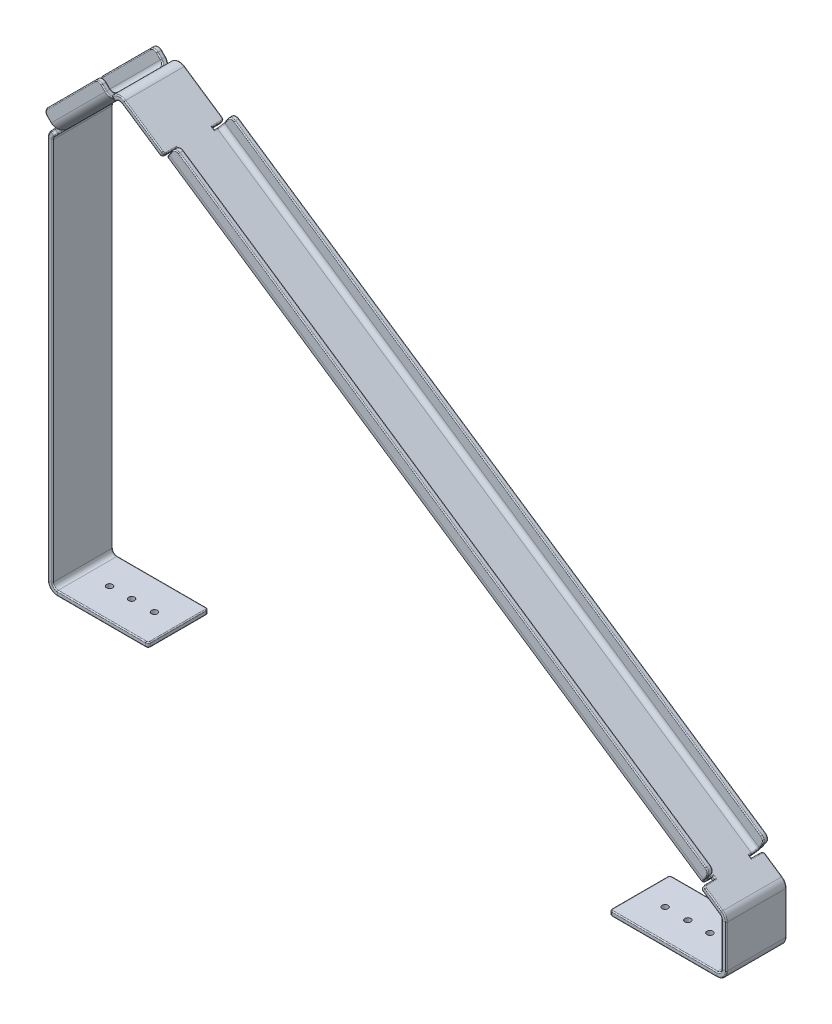
from build123d import *

# Parameters (mm, degrees)
SKETCH2_W                     = 100
SKETCH2_H                     = 60
BASE_FLANGE1_DEPTH            = 4.76
EDGE_FLANGE1_STRIP_W          = 28.5132
EDGE_FLANGE1_STRIP_H          = 4.76
EDGE_FLANGE1_STRIP_CUT_DEPTH  = 60
EDGE_FLANGE1_DEPTH            = 60
EDGE_FLANGE2_START            = -30
EDGE_FLANGE2_DEPTH            = 60
EDGE_FLANGE2_2_DEPTH          = 60
EDGE_FLANGE3_START            = -30
EDGE_FLANGE3_DEPTH            = 60
EDGE_FLANGE3_2_DEPTH          = 60
EDGE_FLANGE4_START            = -30
EDGE_FLANGE4_DEPTH            = 60
EDGE_FLANGE4_2_DEPTH          = 60
EDGE_FLANGE5_STRIP_W          = 28.56
EDGE_FLANGE5_STRIP_H          = 4.76
EDGE_FLANGE5_STRIP_CUT_DEPTH  = 60
EDGE_FLANGE5_DEPTH            = 60
EDGE_FLANGE6_STRIP_W          = 28.56
EDGE_FLANGE6_STRIP_H          = 4.76
EDGE_FLANGE6_STRIP_CUT_DEPTH  = 642.879783277
EDGE_FLANGE6_RELIEF_W         = 30.94
EDGE_FLANGE6_RELIEF_H         = 2.38
EDGE_FLANGE6_RELIEF_CUT_DEPTH = 4.76
EDGE_FLANGE6_DEPTH            = 642.879783277
EDGE_FLANGE7_STRIP_W          = 28.56
EDGE_FLANGE7_STRIP_H          = 4.76
EDGE_FLANGE7_STRIP_CUT_DEPTH  = 642.879783277
EDGE_FLANGE7_RELIEF_W         = 30.94
EDGE_FLANGE7_RELIEF_H         = 2.38
EDGE_FLANGE7_RELIEF_CUT_DEPTH = 4.76
EDGE_FLANGE7_DEPTH            = 642.879783277
EDGE_FLANGE8_STRIP_W          = 28.56
EDGE_FLANGE8_STRIP_H          = 4.76
EDGE_FLANGE8_STRIP_CUT_DEPTH  = 77.283754222
EDGE_FLANGE8_RELIEF_W         = 30.94
EDGE_FLANGE8_RELIEF_H         = 2.38
EDGE_FLANGE8_RELIEF_CUT_DEPTH = 4.76
EDGE_FLANGE8_DEPTH            = 77.283754222
EDGE_FLANGE9_STRIP_W          = 28.56
EDGE_FLANGE9_STRIP_H          = 4.76
EDGE_FLANGE9_STRIP_CUT_DEPTH  = 77.283754222
EDGE_FLANGE9_RELIEF_W         = 30.94
EDGE_FLANGE9_RELIEF_H         = 2.38
EDGE_FLANGE9_RELIEF_CUT_DEPTH = 4.76
EDGE_FLANGE9_DEPTH            = 77.283754222
FILLET1_R                     = 5
FILLET2_R                     = 2.5
FILLET3_R                     = 2.5
FILLET4_R                     = 1
SKETCH39_R                    = 3
CUT_EXTRUDE1_DEPTH            = 10


# Read off the part's stored shape, not the designer's step: Edge-Flange2, Edge-Flange3, Edge-Flange4
# Sheet-metal steps are written as plain solids
with BuildPart() as part:
    # Sketch2 → Base-Flange1 (new body)
    with BuildSketch(Plane(origin=(0, 0, 0), x_dir=(1, 0, 0), z_dir=(0, 1, 0))):
        Rectangle(SKETCH2_W, SKETCH2_H)
    extrude(amount=-BASE_FLANGE1_DEPTH)

    # Edge-Flange1 strip (across the edge) → Edge-Flange1 strip cut (cut)
    with BuildSketch(Plane(origin=(-50, 0, -30), x_dir=(1, 0, 0), z_dir=(0, 0, 1))):
        with Locations((-4.76, -2.38)):
            Rectangle(EDGE_FLANGE1_STRIP_W, EDGE_FLANGE1_STRIP_H)
    extrude(amount=EDGE_FLANGE1_STRIP_CUT_DEPTH, mode=Mode.SUBTRACT)

    # Edge-Flange1 section (across the edge) → Edge-Flange1 (add)
    with BuildSketch(Plane(origin=(-50, 0, -30), x_dir=(1, 0, 0), z_dir=(0, 0, 1))):
        with BuildLine():
            Line((0, 4.7366), (0, 395.24))
            Line((0, 395.24), (4.76, 395.24))
            Line((4.76, 395.24), (4.76, 4.7366))
            ThreePointArc((4.76, 4.7366), (6.14731802, 1.38731802), (9.4966, 0))
            Line((9.4966, 0), (9.4966, -4.76))
            ThreePointArc((9.4966, -4.76), (2.781489742, -1.978510258), (0, 4.7366))
        make_face()
    extrude(amount=EDGE_FLANGE1_DEPTH)

    # Edge-Flange2 outline → Edge-Flange2 (cut)
    with BuildSketch(Plane.XY.offset(EDGE_FLANGE2_START)):
        with BuildLine():
            ThreePointArc((-50, 386.536686886), (-49.27533315, 390.179833162), (-47.211656557, 393.268343443))
            Line((-47.211656557, 393.268343443), (-45.24, 395.24))
            Line((-45.24, 395.24), (-50, 395.24))
            Line((-50, 395.24), (-50, 386.536686886))
        make_face()
    extrude(amount=EDGE_FLANGE2_DEPTH, mode=Mode.SUBTRACT)

    # Edge-Flange2 2 outline → Edge-Flange2 2 (add)
    with BuildSketch(Plane.XY.offset(EDGE_FLANGE2_START)):
        with BuildLine():
            Line((20.710678119, 461.190678119), (-45.24, 395.24))
            Line((-45.24, 395.24), (-45.24, 386.536686886))
            ThreePointArc((-45.24, 386.536686886), (-44.877666575, 388.358260024), (-43.845828278, 389.902515165))
            Line((-43.845828278, 389.902515165), (24.076506397, 457.82484984))
            Line((24.076506397, 457.82484984), (20.710678119, 461.190678119))
        make_face()
    extrude(amount=EDGE_FLANGE2_2_DEPTH)

    # Edge-Flange3 outline → Edge-Flange3 (cut)
    with BuildSketch(Plane.XY.offset(EDGE_FLANGE3_START)):
        with BuildLine():
            ThreePointArc((14.507277941, 454.987277941), (18.774977189, 457.45123525), (23.702891807, 457.45123525))
            Line((23.702891807, 457.45123525), (24.076506397, 457.82484984))
            Line((24.076506397, 457.82484984), (20.710678119, 461.190678119))
            Line((20.710678119, 461.190678119), (14.507277941, 454.987277941))
        make_face()
    extrude(amount=EDGE_FLANGE3_DEPTH, mode=Mode.SUBTRACT)

    # Edge-Flange3 2 outline → Edge-Flange3 2 (add)
    with BuildSketch(Plane.XY.offset(EDGE_FLANGE3_START)):
        with BuildLine():
            Line((628.570005633, 50.08883623), (26.562450939, 456.148059075))
            ThreePointArc((26.562450939, 456.148059075), (25.186814168, 456.918452683), (23.702891807, 457.45123525))
            Line((23.702891807, 457.45123525), (17.873106219, 451.621449662))
            ThreePointArc((17.873106219, 451.621449662), (20.782708715, 452.993707288), (23.900692718, 452.201840229))
            Line((23.900692718, 452.201840229), (625.908247412, 46.142617385))
            Line((625.908247412, 46.142617385), (628.570005633, 50.08883623))
        make_face()
    extrude(amount=EDGE_FLANGE3_2_DEPTH)

    # Edge-Flange4 outline → Edge-Flange4 (cut)
    with BuildSketch(Plane.XY.offset(EDGE_FLANGE4_START)):
        with BuildLine():
            ThreePointArc((621.711763853, 54.714778721), (624.793908496, 51.291710308), (625.908247412, 46.82234103))
            Line((625.908247412, 46.82234103), (625.908247412, 46.142617385))
            Line((625.908247412, 46.142617385), (628.570005633, 50.08883623))
            Line((628.570005633, 50.08883623), (621.711763853, 54.714778721))
        make_face()
    extrude(amount=EDGE_FLANGE4_DEPTH, mode=Mode.SUBTRACT)

    # Edge-Flange4 2 outline → Edge-Flange4 2 (add)
    with BuildSketch(Plane.XY.offset(EDGE_FLANGE4_START)):
        with BuildLine():
            Line((625.908247412, -4.865785181), (625.908247412, 46.142617385))
            Line((625.908247412, 46.142617385), (619.050005633, 50.768559875))
            ThreePointArc((619.050005633, 50.768559875), (620.591077954, 49.057025669), (621.148247412, 46.82234103))
            Line((621.148247412, 46.82234103), (621.148247412, -4.865785181))
            Line((621.148247412, -4.865785181), (625.908247412, -4.865785181))
        make_face()
    extrude(amount=EDGE_FLANGE4_2_DEPTH)

    # Edge-Flange5 strip (across the edge) → Edge-Flange5 strip cut (cut)
    with BuildSketch(Plane(origin=(621.148247412, -4.865785181, -30), x_dir=(0, 1, 0), z_dir=(0, 0, 1))):
        with Locations((-4.76, -2.38)):
            Rectangle(EDGE_FLANGE5_STRIP_W, EDGE_FLANGE5_STRIP_H)
    extrude(amount=EDGE_FLANGE5_STRIP_CUT_DEPTH, mode=Mode.SUBTRACT)

    # Edge-Flange5 section (across the edge) → Edge-Flange5 (add)
    with BuildSketch(Plane(origin=(621.148247412, -4.865785181, -30), x_dir=(0, 1, 0), z_dir=(0, 0, 1))):
        with BuildLine():
            Line((0, 4.76), (0, 111.4966))
            Line((0, 111.4966), (4.76, 111.4966))
            Line((4.76, 111.4966), (4.76, 4.76))
            ThreePointArc((4.76, 4.76), (6.154171722, 1.394171722), (9.52, 0))
            Line((9.52, 0), (9.52, -4.76))
            ThreePointArc((9.52, -4.76), (2.788343443, -1.971656557), (0, 4.76))
        make_face()
    extrude(amount=EDGE_FLANGE5_DEPTH)

    # Edge-Flange6 strip (across the edge) → Edge-Flange6 strip cut (cut)
    with BuildSketch(Plane(origin=(68.014329566, 428.188413901, 30), x_dir=(0, 0, -1), z_dir=(0.8290375725550491, -0.559192903470736, 0))):
        with Locations((-4.76, -2.38)):
            Rectangle(EDGE_FLANGE6_STRIP_W, EDGE_FLANGE6_STRIP_H)
    extrude(amount=EDGE_FLANGE6_STRIP_CUT_DEPTH, mode=Mode.SUBTRACT)

    # Edge-Flange6 relief (on the sheet) → Edge-Flange6 relief cut (cut)
    with BuildSketch(Plane(origin=(68.014329566, 428.188413901, 20.48), x_dir=(0, 0, -1), z_dir=(0.559192903470736, 0.8290375725550491, 6.8742211887429995e-15))):
        with Locations((-13.09, 1.19)):
            Rectangle(EDGE_FLANGE6_RELIEF_W, EDGE_FLANGE6_RELIEF_H)
        with Locations((-13.09, -644.069783277)):
            Rectangle(EDGE_FLANGE6_RELIEF_W, EDGE_FLANGE6_RELIEF_H)
    extrude(amount=-EDGE_FLANGE6_RELIEF_CUT_DEPTH, mode=Mode.SUBTRACT)

    # Edge-Flange6 section (across the edge) → Edge-Flange6 (add)
    with BuildSketch(Plane(origin=(68.014329566, 428.188413901, 30), x_dir=(0, 0, -1), z_dir=(0.8290375725550491, -0.559192903470736, 0))):
        with BuildLine():
            Line((0, 4.76), (0, 15.24))
            Line((0, 15.24), (4.76, 15.24))
            Line((4.76, 15.24), (4.76, 4.76))
            ThreePointArc((4.76, 4.76), (6.154171722, 1.394171722), (9.52, 0))
            Line((9.52, 0), (9.52, -4.76))
            ThreePointArc((9.52, -4.76), (2.788343443, -1.971656557), (0, 4.76))
        make_face()
    extrude(amount=EDGE_FLANGE6_DEPTH)

    # Edge-Flange7 strip (across the edge) → Edge-Flange7 strip cut (cut)
    with BuildSketch(Plane(origin=(600.985824539, 68.694601307, -30), x_dir=(0, 0, 1), z_dir=(-0.829037572555049, 0.5591929034707361, 0))):
        with Locations((-4.76, -2.38)):
            Rectangle(EDGE_FLANGE7_STRIP_W, EDGE_FLANGE7_STRIP_H)
    extrude(amount=EDGE_FLANGE7_STRIP_CUT_DEPTH, mode=Mode.SUBTRACT)

    # Edge-Flange7 relief (on the sheet) → Edge-Flange7 relief cut (cut)
    with BuildSketch(Plane(origin=(600.985824539, 68.694601307, -20.48), x_dir=(0, 0, 1), z_dir=(0.5591929034707361, 0.829037572555049, -6.943642976771755e-15))):
        with Locations((-13.09, 1.19)):
            Rectangle(EDGE_FLANGE7_RELIEF_W, EDGE_FLANGE7_RELIEF_H)
        with Locations((-13.09, -644.069783277)):
            Rectangle(EDGE_FLANGE7_RELIEF_W, EDGE_FLANGE7_RELIEF_H)
    extrude(amount=-EDGE_FLANGE7_RELIEF_CUT_DEPTH, mode=Mode.SUBTRACT)

    # Edge-Flange7 section (across the edge) → Edge-Flange7 (add)
    with BuildSketch(Plane(origin=(600.985824539, 68.694601307, -30), x_dir=(0, 0, 1), z_dir=(-0.829037572555049, 0.5591929034707361, 0))):
        with BuildLine():
            Line((0, 4.76), (0, 15.24))
            Line((0, 15.24), (4.76, 15.24))
            Line((4.76, 15.24), (4.76, 4.76))
            ThreePointArc((4.76, 4.76), (6.154171722, 1.394171722), (9.52, 0))
            Line((9.52, 0), (9.52, -4.76))
            ThreePointArc((9.52, -4.76), (2.788343443, -1.971656557), (0, 4.76))
        make_face()
    extrude(amount=EDGE_FLANGE7_DEPTH)

    # Edge-Flange8 strip (across the edge) → Edge-Flange8 strip cut (cut)
    with BuildSketch(Plane(origin=(-43.676122651, 396.803877349, 30), x_dir=(0, 0, -1), z_dir=(0.7071067811865411, 0.7071067811865539, 0))):
        with Locations((-4.76, -2.38)):
            Rectangle(EDGE_FLANGE8_STRIP_W, EDGE_FLANGE8_STRIP_H)
    extrude(amount=EDGE_FLANGE8_STRIP_CUT_DEPTH, mode=Mode.SUBTRACT)

    # Edge-Flange8 relief (on the sheet) → Edge-Flange8 relief cut (cut)
    with BuildSketch(Plane(origin=(-43.676122651, 396.803877349, 20.48), x_dir=(0, 0, -1), z_dir=(-0.7071067811865539, 0.7071067811865411, 6.945684747947444e-15))):
        with Locations((-13.09, 1.19)):
            Rectangle(EDGE_FLANGE8_RELIEF_W, EDGE_FLANGE8_RELIEF_H)
        with Locations((-13.09, -78.473754222)):
            Rectangle(EDGE_FLANGE8_RELIEF_W, EDGE_FLANGE8_RELIEF_H)
    extrude(amount=-EDGE_FLANGE8_RELIEF_CUT_DEPTH, mode=Mode.SUBTRACT)

    # Edge-Flange8 section (across the edge) → Edge-Flange8 (add)
    with BuildSketch(Plane(origin=(-43.676122651, 396.803877349, 30), x_dir=(0, 0, -1), z_dir=(0.7071067811865411, 0.7071067811865539, 0))):
        with BuildLine():
            Line((0, 4.76), (0, 15.24))
            Line((0, 15.24), (4.76, 15.24))
            Line((4.76, 15.24), (4.76, 4.76))
            ThreePointArc((4.76, 4.76), (6.154171722, 1.394171722), (9.52, 0))
            Line((9.52, 0), (9.52, -4.76))
            ThreePointArc((9.52, -4.76), (2.788343443, -1.971656557), (0, 4.76))
        make_face()
    extrude(amount=EDGE_FLANGE8_DEPTH)

    # Edge-Flange9 strip (across the edge) → Edge-Flange9 strip cut (cut)
    with BuildSketch(Plane(origin=(10.971744035, 451.451744035, -30), x_dir=(0, 0, 1), z_dir=(-0.7071067811865414, -0.7071067811865538, 0))):
        with Locations((-4.76, -2.38)):
            Rectangle(EDGE_FLANGE9_STRIP_W, EDGE_FLANGE9_STRIP_H)
    extrude(amount=EDGE_FLANGE9_STRIP_CUT_DEPTH, mode=Mode.SUBTRACT)

    # Edge-Flange9 relief (on the sheet) → Edge-Flange9 relief cut (cut)
    with BuildSketch(Plane(origin=(10.971744035, 451.451744035, -20.48), x_dir=(0, 0, 1), z_dir=(-0.7071067811865538, 0.7071067811865414, -6.9849370594145335e-15))):
        with Locations((-13.09, 1.19)):
            Rectangle(EDGE_FLANGE9_RELIEF_W, EDGE_FLANGE9_RELIEF_H)
        with Locations((-13.09, -78.473754222)):
            Rectangle(EDGE_FLANGE9_RELIEF_W, EDGE_FLANGE9_RELIEF_H)
    extrude(amount=-EDGE_FLANGE9_RELIEF_CUT_DEPTH, mode=Mode.SUBTRACT)

    # Edge-Flange9 section (across the edge) → Edge-Flange9 (add)
    with BuildSketch(Plane(origin=(10.971744035, 451.451744035, -30), x_dir=(0, 0, 1), z_dir=(-0.7071067811865414, -0.7071067811865538, 0))):
        with BuildLine():
            Line((0, 4.76), (0, 15.24))
            Line((0, 15.24), (4.76, 15.24))
            Line((4.76, 15.24), (4.76, 4.76))
            ThreePointArc((4.76, 4.76), (6.154171722, 1.394171722), (9.52, 0))
            Line((9.52, 0), (9.52, -4.76))
            ThreePointArc((9.52, -4.76), (2.788343443, -1.971656557), (0, 4.76))
        make_face()
    extrude(amount=EDGE_FLANGE9_DEPTH)

    # Fillet1
    fillet1_edges = [part.edges().sort_by_distance(p)[0] for p in [
        (76.536429415, 440.822946507, 27.62),
        (609.507924388, 81.329133913, 27.62),
        (609.507924388, 81.329133913, -27.62),
        (76.536429415, 440.822946507, -27.62),
        (-54.452429996, 407.580184694, 27.62),
        (0.195436689, 462.22805138, 27.62),
        (0.195436689, 462.22805138, -27.62),
        (-54.452429996, 407.580184694, -27.62),
    ]]
    fillet(fillet1_edges, radius=FILLET1_R)

    # Fillet2
    fillet2_edges = [part.edges().sort_by_distance(p)[0] for p in [
        (601.628054852, 65.390612775, 30),
        (64.710341033, 427.546183589, 30),
        (64.710341033, 427.546183589, -30),
        (601.628054852, 65.390612775, -30),
        (14.337572313, 451.451744035, 30),
        (-43.676122651, 393.438049071, 30),
        (-43.676122651, 393.438049071, -30),
        (14.337572313, 451.451744035, -30),
    ]]
    fillet(fillet2_edges, radius=FILLET2_R)

    # Fillet3
    fillet3_edges = [part.edges().sort_by_distance(p)[0] for p in [
        (509.651647412, -2.485785181, -30),
        (509.651647412, -2.485785181, 30),
        (50, -2.38, 30),
        (50, -2.38, -30),
    ]]
    fillet(fillet3_edges, radius=FILLET3_R)

    # Fillet4
    fillet4_edges = [part.edges().sort_by_distance(p)[0] for p in [
        (42.603780355, 439.586448327, 30),
        (45.265538576, 443.532667173, 30),
        (610.709887653, 56.394040484, -30),
        (613.371645873, 60.34025933, -30),
        (624.793908496, 51.291710308, -30),
        (624.793908496, 51.291710308, 30),
        (620.591077954, 49.057025669, -30),
        (620.591077954, 49.057025669, 30),
        (621.148247412, 25.738277925, 30),
        (625.908247412, 25.738277925, 30),
        (3.4983, 0, 30),
        (621.148247412, 25.738277925, -30),
        (625.908247412, 25.738277925, -30),
        (3.4983, -4.76, 30),
        (623.119903969, -2.077441738, -30),
        (623.119903969, -2.077441738, 30),
        (619.754075691, 1.288386541, -30),
        (619.754075691, 1.288386541, 30),
        (564.269947412, -0.105785181, 30),
        (564.269947412, -4.865785181, 30),
        (63.379461923, 425.573074166, 22.8),
        (64.366016635, 424.907634611, 18.1),
        (65.352571346, 424.242195056, 19.29),
        (598.324066319, 64.748382462, 19.29),
        (599.31062103, 64.082942907, 18.1),
        (601.972379251, 68.029161752, 18.1),
        (600.985824539, 68.694601307, 19.29),
        (68.014329566, 428.188413901, 19.29),
        (67.027774855, 428.853853456, 18.1),
        (66.041220144, 429.519293011, 22.8),
        (66.911793212, 426.553836535, 27.211656557),
        (599.883288185, 67.060023942, 27.211656557),
        (68.793940499, 429.344234641, 23.845828278),
        (601.765435472, 69.850422047, 23.845828278),
        (605.179771315, 74.912383102, 25.24),
        (605.179771315, 74.912383102, 30),
        (599.31062103, 64.082942907, -18.1),
        (598.324066319, 64.748382462, -19.29),
        (65.352571346, 424.242195056, -19.29),
        (64.366016635, 424.907634611, -18.1),
        (600.297175742, 63.417503352, -22.8),
        (67.027774855, 428.853853456, -18.1),
        (68.014329566, 428.188413901, -19.29),
        (600.985824539, 68.694601307, -19.29),
        (601.972379251, 68.029161752, -18.1),
        (602.958933962, 67.363722197, -22.8),
        (599.883288185, 67.060023942, -27.211656557),
        (66.911793212, 426.553836535, -27.211656557),
        (601.765435472, 69.850422047, -23.845828278),
        (68.793940499, 429.344234641, -23.845828278),
        (72.208276342, 434.406195695, -25.24),
        (72.208276342, 434.406195695, -30),
        (-47.218510258, -1.978510258, -30),
        (-47.218510258, -1.978510258, 30),
        (-43.85268198, 1.38731802, -30),
        (-43.85268198, 1.38731802, 30),
        (-41.993208512, 391.755134931, 22.8),
        (-41.151751442, 392.596592001, 18.1),
        (-40.310294373, 393.438049071, 19.29),
        (14.337572313, 448.085915756, 19.29),
        (15.179029383, 448.927372826, 18.1),
        (11.813201104, 452.293201104, 18.1),
        (10.971744035, 451.451744035, 19.29),
        (-43.676122651, 396.803877349, 19.29),
        (-44.517579721, 395.962420279, 18.1),
        (-45.35903679, 395.12096321, 22.8),
        (-42.281950929, 395.409705627, 27.211656557),
        (12.365915756, 450.057572313, 27.211656557),
        (-44.661950929, 397.789705627, 23.845828278),
        (9.985915756, 452.437572313, 23.845828278),
        (5.668443176, 456.755044894, 25.24),
        (5.668443176, 456.755044894, 30),
        (15.179029383, 448.927372826, -18.1),
        (14.337572313, 448.085915756, -19.29),
        (-40.310294373, 393.438049071, -19.29),
        (-41.151751442, 392.596592001, -18.1),
        (16.020486452, 449.768829896, -22.8),
        (-44.517579721, 395.962420279, -18.1),
        (-43.676122651, 396.803877349, -19.29),
        (10.971744035, 451.451744035, -19.29),
        (11.813201104, 452.293201104, -18.1),
        (12.654658174, 453.134658174, -22.8),
        (-45.24, 195.636643443, 30),
        (-50, 195.636643443, 30),
        (12.365915756, 450.057572313, -27.211656557),
        (-42.281950929, 395.409705627, -27.211656557),
        (9.985915756, 452.437572313, -23.845828278),
        (-44.661950929, 397.789705627, -23.845828278),
        (-48.97942351, 402.107178208, -25.24),
        (-48.97942351, 402.107178208, -30),
        (605.179771315, 74.912383102, -30),
        (605.179771315, 74.912383102, -25.24),
        (343.022176902, 261.07604021, -25.24),
        (76.931607784, 438.789930044, -25.24),
        (607.474907925, 80.933955545, -25.24),
        (343.022176902, 261.07604021, -30),
        (76.931607784, 438.789930044, -30),
        (607.474907925, 80.933955545, -30),
        (343.022176902, 261.07604021, 25.24),
        (343.022176902, 261.07604021, 30),
        (72.208276342, 434.406195695, 25.24),
        (76.931607784, 438.789930044, 25.24),
        (607.474907925, 80.933955545, 25.24),
        (72.208276342, 434.406195695, 30),
        (76.931607784, 438.789930044, 30),
        (607.474907925, 80.933955545, 30),
        (-27.128496653, 434.904118037, 25.24),
        (-27.128496653, 434.904118037, 30),
        (-48.97942351, 402.107178208, 25.24),
        (-52.381362184, 407.580184694, 25.24),
        (0.195436689, 460.156983568, 25.24),
        (-48.97942351, 402.107178208, 30),
        (-52.381362184, 407.580184694, 30),
        (0.195436689, 460.156983568, 30),
        (5.668443176, 456.755044894, -30),
        (5.668443176, 456.755044894, -25.24),
        (-27.128496653, 434.904118037, -25.24),
        (-52.381362184, 407.580184694, -25.24),
        (0.195436689, 460.156983568, -25.24),
        (-27.128496653, 434.904118037, -30),
        (-52.381362184, 407.580184694, -30),
        (0.195436689, 460.156983568, -30),
        (610.709887653, 56.394040484, 30),
        (613.371645873, 60.34025933, 30),
        (42.603780355, 439.586448327, -30),
        (63.379461923, 425.573074166, -22.8),
        (600.297175742, 63.417503352, 22.8),
        (62.772413215, 425.982533689, 29.267766953),
        (62.772413215, 425.982533689, -29.267766953),
        (600.90422445, 63.008043828, -29.267766953),
        (600.90422445, 63.008043828, 29.267766953),
        (602.958933962, 67.363722197, 22.8),
        (66.041220144, 429.519293011, -22.8),
        (45.265538576, 443.532667173, -30),
        (65.434171436, 429.928752535, 29.267766953),
        (65.434171436, 429.928752535, -29.267766953),
        (603.56598267, 66.954262674, -29.267766953),
        (603.56598267, 66.954262674, 29.267766953),
        (-43.803401871, 389.944941572, -30),
        (-47.16923015, 393.31076985, -30),
        (-41.993208512, 391.755134931, -22.8),
        (17.830679812, 451.579023255, 30),
        (16.020486452, 449.768829896, 22.8),
        (16.538253405, 450.286596848, -29.267766953),
        (16.538253405, 450.286596848, 29.267766953),
        (-42.510975465, 391.237367978, 29.267766953),
        (-42.510975465, 391.237367978, -29.267766953),
        (-45.35903679, 395.12096321, -22.8),
        (12.654658174, 453.134658174, 22.8),
        (14.464851534, 454.944851534, 30),
        (13.172425127, 453.652425127, -29.267766953),
        (13.172425127, 453.652425127, 29.267766953),
        (-45.876803743, 394.603196257, 29.267766953),
        (-45.876803743, 394.603196257, -29.267766953),
        (-45.24, 195.636643443, -30),
        (-50, 195.636643443, -30),
        (50, 0, 0),
        (50, -4.76, 0),
        (3.4983, 0, -30),
        (49.267766953, 0, 29.267766953),
        (49.267766953, 0, -29.267766953),
        (3.4983, -4.76, -30),
        (49.267766953, -4.76, 29.267766953),
        (49.267766953, -4.76, -29.267766953),
        (564.269947412, -4.865785181, -30),
        (564.269947412, -0.105785181, -30),
        (509.651647412, -0.105785181, 0),
        (510.383880459, -0.105785181, 29.267766953),
        (510.383880459, -0.105785181, -29.267766953),
        (509.651647412, -4.865785181, 0),
        (510.383880459, -4.865785181, 29.267766953),
        (510.383880459, -4.865785181, -29.267766953),
        (-49.27533315, 390.179833162, -30),
        (-49.27533315, 390.179833162, 30),
        (-44.877666575, 388.358260024, -30),
        (-44.877666575, 388.358260024, 30),
        (-43.803401871, 389.944941572, 30),
        (-47.16923015, 393.31076985, 30),
        (17.830679812, 451.579023255, -30),
        (14.464851534, 454.944851534, -30),
        (18.774977189, 457.45123525, -30),
        (18.774977189, 457.45123525, 30),
        (20.782708715, 452.993707288, -30),
        (20.782708715, 452.993707288, 30),
    ]]
    fillet(fillet4_edges, radius=FILLET4_R)

    # Sketch39 → Cut-Extrude1 (cut)
    with BuildSketch(Plane.XZ.offset(4.76)):
        with BuildLine():
            ThreePointArc((29.24915, 0), (26.24915, 3), (23.24915, 0))
            Line((23.24915, 0), (29.24915, 0))
        make_face()
        with BuildLine():
            Line((29.24915, 0), (23.24915, 0))
            ThreePointArc((23.24915, 0), (26.24915, -3), (29.24915, 0))
        make_face()
        with BuildLine():
            Line((3.4983, -3), (3.4983, 0))
            Line((3.4983, 0), (0.4983, 0))
            ThreePointArc((0.4983, 0), (1.376979656, -2.121320344), (3.4983, -3))
        make_face()
        with BuildLine():
            Line((0.4983, 0), (3.4983, 0))
            Line((3.4983, 0), (3.4983, 3))
            ThreePointArc((3.4983, 3), (1.376979656, 2.121320344), (0.4983, 0))
        make_face()
        with BuildLine():
            Line((6.4983, 0), (3.4983, 0))
            Line((3.4983, 0), (3.4983, -3))
            ThreePointArc((3.4983, -3), (5.619620344, -2.121320344), (6.4983, 0))
        make_face()
        with BuildLine():
            Line((3.4983, 3), (3.4983, 0))
            Line((3.4983, 0), (6.4983, 0))
            ThreePointArc((6.4983, 0), (5.619620344, 2.121320344), (3.4983, 3))
        make_face()
        with BuildLine():
            ThreePointArc((-21.50255, 0), (-18.50255, -3), (-15.50255, 0))
            Line((-15.50255, 0), (-21.50255, 0))
        make_face()
        with BuildLine():
            Line((-21.50255, 0), (-15.50255, 0))
            ThreePointArc((-15.50255, 0), (-18.50255, 3), (-21.50255, 0))
        make_face()
        with Locations(Location((579.599484654, 0, 0), (0, 0, 270))):
            Circle(SKETCH39_R)
        with Locations(Location((557.598634654, 0, 0), (0, 0, 270))):
            Circle(SKETCH39_R)
        with Locations(Location((534.847784654, 0, 0), (0, 0, 270))):
            Circle(SKETCH39_R)
    extrude(amount=-CUT_EXTRUDE1_DEPTH, mode=Mode.SUBTRACT)


solid = part.part
